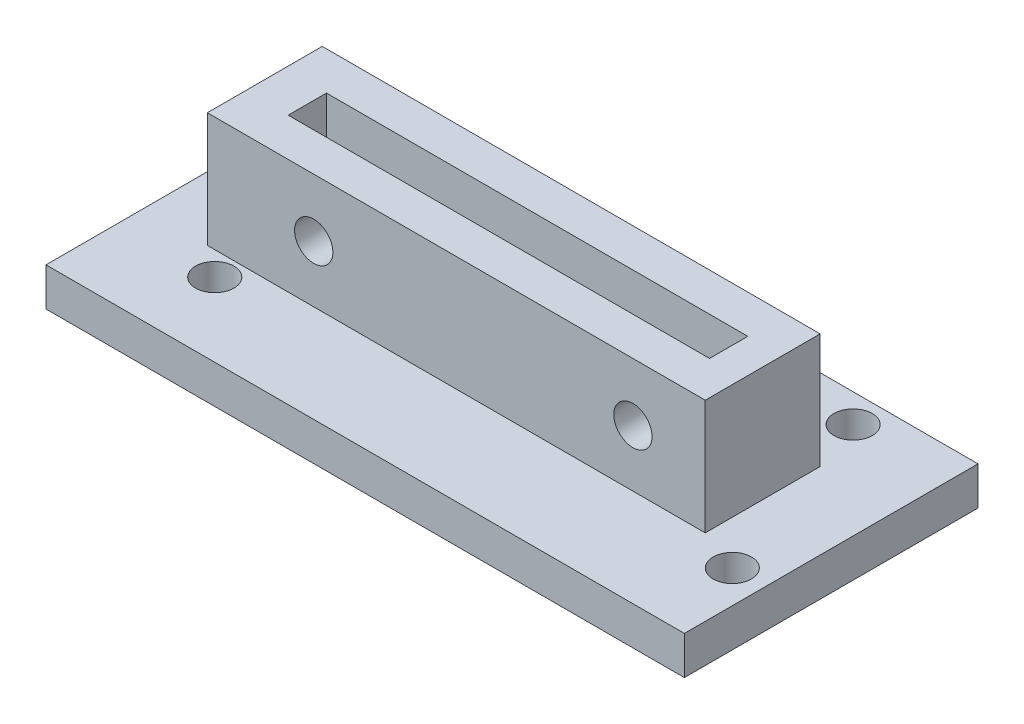
from build123d import *

# Parameters (mm, degrees)
SKETCH1_W           = 50
SKETCH1_H           = 23
SKETCH1_R           = 1.5
BOSS_EXTRUDE1_DEPTH = 3
SKETCH2_W           = 39
SKETCH2_H           = 9
SKETCH2_W_2         = 33
SKETCH2_H_2         = 3
BOSS_EXTRUDE2_DEPTH = 9
SKETCH3_R           = 1.5
CUT_EXTRUDE1_DEPTH  = 35.361983


with BuildPart() as part:
    # Sketch1 → Boss-Extrude1 (new body)
    with BuildSketch(Plane(origin=(0, 0, 0), x_dir=(1, 0, 0), z_dir=(0, 1, 0))):
        with Locations((3.296703297, 1.472527473)):
            Rectangle(SKETCH1_W, SKETCH1_H)
        with Locations((-19.262346943, 10.748763157)):
            Circle(SKETCH1_R, mode=Mode.SUBTRACT)
        with Locations((20.737653057, 10.748763157)):
            Circle(SKETCH1_R, mode=Mode.SUBTRACT)
        with Locations((25.736863787, -3.71232414)):
            Circle(SKETCH1_R, mode=Mode.SUBTRACT)
        with Locations((-14.263136213, -4.251236843)):
            Circle(SKETCH1_R, mode=Mode.SUBTRACT)
    extrude(amount=BOSS_EXTRUDE1_DEPTH)

    # Sketch2 → Boss-Extrude2 (add)
    with BuildSketch(Plane(origin=(0, 3, 0), x_dir=(1, 0, 0), z_dir=(0, 1, 0))):
        with Locations((2.796703297, 2.108854142)):
            Rectangle(SKETCH2_W, SKETCH2_H)
        with Locations((3.130133065, 2.108854142)):
            Rectangle(SKETCH2_W_2, SKETCH2_H_2, mode=Mode.SUBTRACT)
    extrude(amount=BOSS_EXTRUDE2_DEPTH)

    # Sketch3 → Cut-Extrude1 (cut, through all)
    with BuildSketch(Plane.XY.offset(2.391145858)):
        with Locations((-8.369866935, 7.448129326)):
            Circle(SKETCH3_R)
        with Locations((16.630133065, 7.448129326)):
            Circle(SKETCH3_R)
    extrude(amount=-CUT_EXTRUDE1_DEPTH, mode=Mode.SUBTRACT)


solid = part.part
